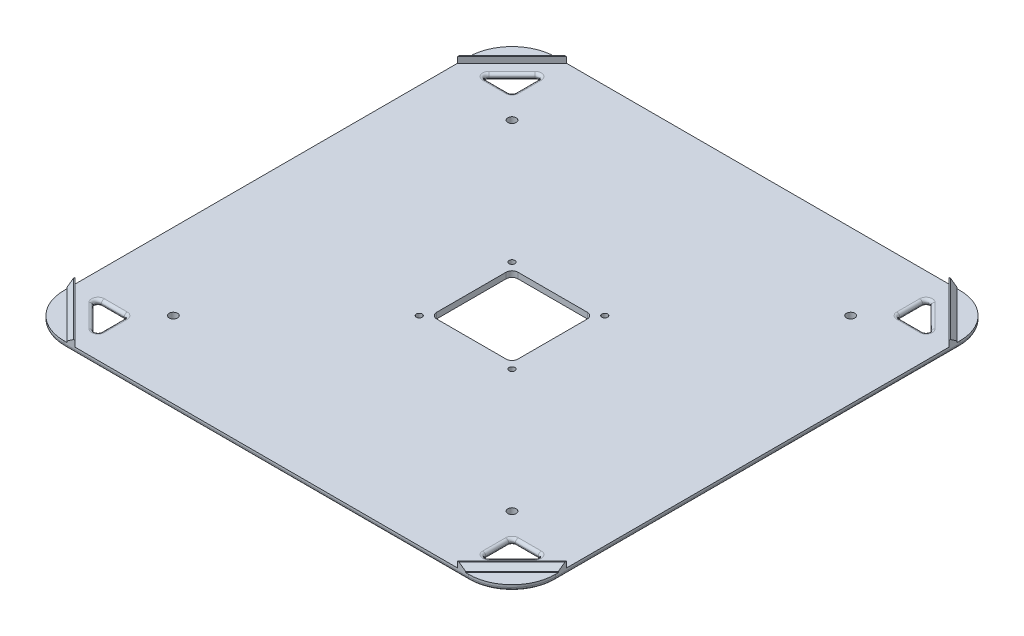
from build123d import *

# Parameters (mm, degrees)
SKETCH1_W           = 269.24
SKETCH1_H           = 269.24
BOSS_EXTRUDE1_DEPTH = 3.175
FILLET1_R           = 23.8125
FILLET2_R           = 1.905
BOSS_EXTRUDE2_DEPTH = 3.175
CUT_EXTRUDE4_REACH  = 192.408
SKETCH8_R           = 2.286
CHAMFER1_SIZE       = 2.54
CUT_EXTRUDE5_REACH  = 192.408
FILLET3_R           = 1.905
FILLET4_R           = 1.5875
FILLET5_R           = 1.5875
CUT_EXTRUDE6_REACH  = 192.487
SKETCH11_W          = 44.45
SKETCH11_H          = 44.45
FILLET6_R           = 3.175
CUT_EXTRUDE7_REACH  = 192.487
SKETCH12_R          = 1.5875


with BuildPart() as part:
    # Sketch1 → Boss-Extrude1 (new body)
    with BuildSketch(Plane(origin=(0, 0, 0), x_dir=(1, 0, 0), z_dir=(0, 1, 0))):
        Rectangle(SKETCH1_W, SKETCH1_H)
    extrude(amount=BOSS_EXTRUDE1_DEPTH)

    # Fillet1
    fillet1_edges = [part.edges().sort_by_distance(p)[0] for p in [
        (134.62, 1.5875, 134.62),
        (-134.62, 1.5875, 134.62),
        (-134.62, 1.5875, -134.62),
        (134.62, 1.5875, -134.62),
    ]]
    fillet(fillet1_edges, radius=FILLET1_R)

    # Fillet2
    fillet2_edges = [part.edges().sort_by_distance(p)[0] for p in [
        (134.62, 0, 0),
        (0, 0, 134.62),
        (-134.62, 0, 0),
        (0, 0, -134.62),
        (-127.645480227, 0, 127.645480227),
        (-127.645480227, 0, -127.645480227),
        (127.645480227, 0, -127.645480227),
        (127.645480227, 0, 127.645480227),
    ]]
    fillet(fillet2_edges, radius=FILLET2_R)

    # Sketch9 → Boss-Extrude2 (add)
    with BuildSketch(Plane(origin=(0, 3.175, 0), x_dir=(1, 0, 0), z_dir=(0, 1, 0))):
        Polygon((-134.62, 104.729871939), (-104.729871939, 134.62), (-109.22, 134.62), (-134.62, 109.22), align=None)
        Polygon((104.729871939, 134.62), (134.62, 104.729871939), (134.62, 109.22), (109.22, 134.62), align=None)
        Polygon((-109.22, -134.62), (-134.62, -109.22), (-134.62, -104.729871939), (-104.729871939, -134.62), align=None)
        Polygon((104.729871939, -134.62), (134.62, -104.729871939), (134.62, -109.22), (109.22, -134.62), align=None)
    extrude(amount=BOSS_EXTRUDE2_DEPTH)

    # Sketch8 → Cut-Extrude4 (cut, up to next)
    with BuildSketch(Plane(origin=(0, 3.175, 0), x_dir=(1, 0, 0), z_dir=(0, 1, 0)), mode=Mode.PRIVATE) as cut_extrude4_sk1:
        with Locations(Location((-92.734167607, -92.734167607, 0), (0, 0, 270))):
            Circle(SKETCH8_R)
    cut_extrude4_tool1 = extrude(cut_extrude4_sk1.sketch, amount=-CUT_EXTRUDE4_REACH, mode=Mode.PRIVATE) & part.part
    # Sketch8 → Cut-Extrude4 (cut, up to next)
    with BuildSketch(Plane(origin=(0, 3.175, 0), x_dir=(1, 0, 0), z_dir=(0, 1, 0)), mode=Mode.PRIVATE) as cut_extrude4_sk2:
        with Locations(Location((92.734167607, -92.734167607, 0), (0, 0, 270))):
            Circle(SKETCH8_R)
    cut_extrude4_tool2 = extrude(cut_extrude4_sk2.sketch, amount=-CUT_EXTRUDE4_REACH, mode=Mode.PRIVATE) & part.part
    # Sketch8 → Cut-Extrude4 (cut, up to next)
    with BuildSketch(Plane(origin=(0, 3.175, 0), x_dir=(1, 0, 0), z_dir=(0, 1, 0)), mode=Mode.PRIVATE) as cut_extrude4_sk3:
        with Locations(Location((-92.734167607, 92.734167607, 0), (0, 0, 270))):
            Circle(SKETCH8_R)
    cut_extrude4_tool3 = extrude(cut_extrude4_sk3.sketch, amount=-CUT_EXTRUDE4_REACH, mode=Mode.PRIVATE) & part.part
    # Sketch8 → Cut-Extrude4 (cut, up to next)
    with BuildSketch(Plane(origin=(0, 3.175, 0), x_dir=(1, 0, 0), z_dir=(0, 1, 0)), mode=Mode.PRIVATE) as cut_extrude4_sk4:
        with Locations(Location((92.734167607, 92.734167607, 0), (0, 0, 270))):
            Circle(SKETCH8_R)
    cut_extrude4_tool4 = extrude(cut_extrude4_sk4.sketch, amount=-CUT_EXTRUDE4_REACH, mode=Mode.PRIVATE) & part.part
    add(cut_extrude4_tool1.solids().sort_by_distance((-92.734168, 3.175, 92.734168))[0], mode=Mode.SUBTRACT)
    add(cut_extrude4_tool2.solids().sort_by_distance((92.734168, 3.175, 92.734168))[0], mode=Mode.SUBTRACT)
    add(cut_extrude4_tool3.solids().sort_by_distance((-92.734168, 3.175, -92.734168))[0], mode=Mode.SUBTRACT)
    add(cut_extrude4_tool4.solids().sort_by_distance((92.734168, 3.175, -92.734168))[0], mode=Mode.SUBTRACT)

    # Chamfer1
    chamfer1_edges = [part.edges().sort_by_distance(p)[0] for p in [
        (121.92, 6.35, 121.92),
        (-121.92, 6.35, -121.92),
        (121.92, 6.35, -121.92),
        (-121.92, 6.35, 121.92),
    ]]
    chamfer(chamfer1_edges, length=CHAMFER1_SIZE)

    # Sketch10 → Cut-Extrude5 (cut, up to next)
    with BuildSketch(Plane(origin=(0, 3.175, 0), x_dir=(1, 0, 0), z_dir=(0, 1, 0)), mode=Mode.PRIVATE) as cut_extrude5_sk1:
        Polygon((-124.260795103, -105.210795103), (-105.210795103, -124.260795103), (-105.210795103, -105.210795103), align=None)
    cut_extrude5_tool1 = extrude(cut_extrude5_sk1.sketch, amount=-CUT_EXTRUDE5_REACH, mode=Mode.PRIVATE) & part.part
    # Sketch10 → Cut-Extrude5 (cut, up to next)
    with BuildSketch(Plane(origin=(0, 3.175, 0), x_dir=(1, 0, 0), z_dir=(0, 1, 0)), mode=Mode.PRIVATE) as cut_extrude5_sk2:
        Polygon((-105.210795103, 105.210795103), (-105.210795103, 124.260795103), (-124.260795103, 105.210795103), align=None)
    cut_extrude5_tool2 = extrude(cut_extrude5_sk2.sketch, amount=-CUT_EXTRUDE5_REACH, mode=Mode.PRIVATE) & part.part
    # Sketch10 → Cut-Extrude5 (cut, up to next)
    with BuildSketch(Plane(origin=(0, 3.175, 0), x_dir=(1, 0, 0), z_dir=(0, 1, 0)), mode=Mode.PRIVATE) as cut_extrude5_sk3:
        Polygon((105.210795103, 105.210795103), (124.260795103, 105.210795103), (105.210795103, 124.260795103), align=None)
    cut_extrude5_tool3 = extrude(cut_extrude5_sk3.sketch, amount=-CUT_EXTRUDE5_REACH, mode=Mode.PRIVATE) & part.part
    # Sketch10 → Cut-Extrude5 (cut, up to next)
    with BuildSketch(Plane(origin=(0, 3.175, 0), x_dir=(1, 0, 0), z_dir=(0, 1, 0)), mode=Mode.PRIVATE) as cut_extrude5_sk4:
        Polygon((105.210795103, -105.210795103), (105.210795103, -124.260795103), (124.260795103, -105.210795103), align=None)
    cut_extrude5_tool4 = extrude(cut_extrude5_sk4.sketch, amount=-CUT_EXTRUDE5_REACH, mode=Mode.PRIVATE) & part.part
    add(cut_extrude5_tool1.solids().sort_by_distance((-111.560795, 3.175, 111.560795))[0], mode=Mode.SUBTRACT)
    add(cut_extrude5_tool2.solids().sort_by_distance((-111.560795, 3.175, -111.560795))[0], mode=Mode.SUBTRACT)
    add(cut_extrude5_tool3.solids().sort_by_distance((111.560795, 3.175, -111.560795))[0], mode=Mode.SUBTRACT)
    add(cut_extrude5_tool4.solids().sort_by_distance((111.560795, 3.175, 111.560795))[0], mode=Mode.SUBTRACT)

    # Fillet3
    fillet3_edges = [part.edges().sort_by_distance(p)[0] for p in [
        (105.210795103, 1.5875, 124.260795103),
        (105.210795103, 1.5875, 105.210795103),
        (124.260795103, 1.5875, 105.210795103),
        (124.260795103, 1.5875, -105.210795103),
        (105.210795103, 1.5875, -105.210795103),
        (105.210795103, 1.5875, -124.260795103),
        (-105.210795103, 1.5875, -124.260795103),
        (-105.210795103, 1.5875, -105.210795103),
        (-124.260795103, 1.5875, -105.210795103),
        (-105.210795103, 1.5875, 124.260795103),
        (-124.260795103, 1.5875, 105.210795103),
        (-105.210795103, 1.5875, 105.210795103),
    ]]
    fillet(fillet3_edges, radius=FILLET3_R)

    # Fillet4
    fillet4_edges = [part.edges().sort_by_distance(p)[0] for p in [
        (105.210795103, 0, 113.388756685),
        (113.388756685, 0, 105.210795103),
        (114.735795103, 0, 114.735795103),
        (105.210795103, 0, -113.388756685),
        (114.735795103, 0, -114.735795103),
        (113.388756685, 0, -105.210795103),
        (-114.735795103, 0, -114.735795103),
        (-105.210795103, 0, -113.388756685),
        (-113.388756685, 0, -105.210795103),
        (-113.388756685, 0, 105.210795103),
        (-105.210795103, 0, 113.388756685),
        (-114.735795103, 0, 114.735795103),
        (105.768756685, 0, 105.768756685),
        (121.421708776, 0, 106.386783164),
        (106.386783164, 0, 121.421708776),
        (106.386783164, 0, -121.421708776),
        (121.421708776, 0, -106.386783164),
        (105.768756685, 0, -105.768756685),
        (-106.386783164, 0, -121.421708776),
        (-105.768756685, 0, -105.768756685),
        (-121.421708776, 0, -106.386783164),
        (-105.768756685, 0, 105.768756685),
        (-106.386783164, 0, 121.421708776),
        (-121.421708776, 0, 106.386783164),
    ]]
    fillet(fillet4_edges, radius=FILLET4_R)

    # Fillet5
    fillet5_edges = [part.edges().sort_by_distance(p)[0] for p in [
        (105.768756685, 3.175, 105.768756685),
        (113.388756685, 3.175, 105.210795103),
        (121.421708776, 3.175, 106.386783164),
        (114.735795103, 3.175, 114.735795103),
        (106.386783164, 3.175, 121.421708776),
        (105.768756685, 3.175, -105.768756685),
        (105.210795103, 3.175, -113.388756685),
        (106.386783164, 3.175, -121.421708776),
        (114.735795103, 3.175, -114.735795103),
        (121.421708776, 3.175, -106.386783164),
        (-121.421708776, 3.175, -106.386783164),
        (-114.735795103, 3.175, -114.735795103),
        (-106.386783164, 3.175, -121.421708776),
        (-105.210795103, 3.175, -113.388756685),
        (-105.768756685, 3.175, -105.768756685),
        (-121.421708776, 3.175, 106.386783164),
        (-113.388756685, 3.175, 105.210795103),
        (-105.768756685, 3.175, 105.768756685),
        (-105.210795103, 3.175, 113.388756685),
        (-106.386783164, 3.175, 121.421708776),
        (105.210795103, 3.175, 113.388756685),
        (113.388756685, 3.175, -105.210795103),
        (-113.388756685, 3.175, -105.210795103),
        (-114.735795103, 3.175, 114.735795103),
    ]]
    fillet(fillet5_edges, radius=FILLET5_R - 0.0001)  # a hair under: the kernel refuses the full size

    # Sketch11 → Cut-Extrude6 (cut, up to next)
    with BuildSketch(Plane.XZ, mode=Mode.PRIVATE) as cut_extrude6_sk1:
        Rectangle(SKETCH11_W, SKETCH11_H)
    cut_extrude6_tool1 = extrude(cut_extrude6_sk1.sketch, amount=-CUT_EXTRUDE6_REACH, mode=Mode.PRIVATE) & part.part
    add(cut_extrude6_tool1.solids().sort_by_distance((0, 0, 0))[0], mode=Mode.SUBTRACT)

    # Fillet6
    fillet6_edges = [part.edges().sort_by_distance(p)[0] for p in [
        (22.225, 1.5875, 22.225),
        (22.225, 1.5875, -22.225),
        (-22.225, 1.5875, -22.225),
        (-22.225, 1.5875, 22.225),
    ]]
    fillet(fillet6_edges, radius=FILLET6_R)

    # Sketch12 → Cut-Extrude7 (cut, up to next)
    with BuildSketch(Plane.XZ, mode=Mode.PRIVATE) as cut_extrude7_sk1:
        with Locations(Location((25.4, -25.4, 0), (0, 0, 270))):
            Circle(SKETCH12_R)
    cut_extrude7_tool1 = extrude(cut_extrude7_sk1.sketch, amount=-CUT_EXTRUDE7_REACH, mode=Mode.PRIVATE) & part.part
    # Sketch12 → Cut-Extrude7 (cut, up to next)
    with BuildSketch(Plane.XZ, mode=Mode.PRIVATE) as cut_extrude7_sk2:
        with Locations(Location((-25.4, -25.4, 0), (0, 0, 270))):
            Circle(SKETCH12_R)
    cut_extrude7_tool2 = extrude(cut_extrude7_sk2.sketch, amount=-CUT_EXTRUDE7_REACH, mode=Mode.PRIVATE) & part.part
    # Sketch12 → Cut-Extrude7 (cut, up to next)
    with BuildSketch(Plane.XZ, mode=Mode.PRIVATE) as cut_extrude7_sk3:
        with Locations(Location((-25.4, 25.4, 0), (0, 0, 270))):
            Circle(SKETCH12_R)
    cut_extrude7_tool3 = extrude(cut_extrude7_sk3.sketch, amount=-CUT_EXTRUDE7_REACH, mode=Mode.PRIVATE) & part.part
    # Sketch12 → Cut-Extrude7 (cut, up to next)
    with BuildSketch(Plane.XZ, mode=Mode.PRIVATE) as cut_extrude7_sk4:
        with Locations(Location((25.4, 25.4, 0), (0, 0, 270))):
            Circle(SKETCH12_R)
    cut_extrude7_tool4 = extrude(cut_extrude7_sk4.sketch, amount=-CUT_EXTRUDE7_REACH, mode=Mode.PRIVATE) & part.part
    add(cut_extrude7_tool1.solids().sort_by_distance((25.4, 0, -25.4))[0], mode=Mode.SUBTRACT)
    add(cut_extrude7_tool2.solids().sort_by_distance((-25.4, 0, -25.4))[0], mode=Mode.SUBTRACT)
    add(cut_extrude7_tool3.solids().sort_by_distance((-25.4, 0, 25.4))[0], mode=Mode.SUBTRACT)
    add(cut_extrude7_tool4.solids().sort_by_distance((25.4, 0, 25.4))[0], mode=Mode.SUBTRACT)


solid = part.part
